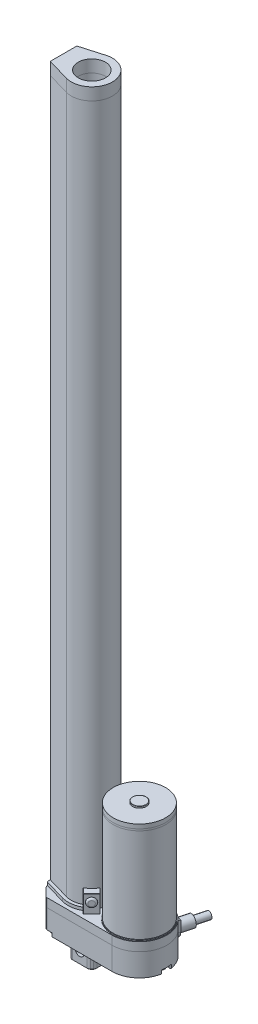
from build123d import *

# Parameters (mm, degrees)
BOSS_EXTRUDE1_DEPTH    = 6.35
SKETCH6_R              = 19.431
BOSS_EXTRUDE4_DEPTH    = 0.762
SKETCH7_R              = 19.05
BOSS_EXTRUDE5_DEPTH    = 68.326
FILLET6_R              = 5.08
FILLET7_R              = 1.905
BOSS_EXTRUDE15_DEPTH   = 6.35
SKETCH24_R             = 4.064
BOSS_EXTRUDE16_DEPTH   = 10.16
SKETCH25_R             = 2.54
BOSS_EXTRUDE17_DEPTH   = 10.16
BOSS_EXTRUDE19_DEPTH   = 16.51
FILLET13_R             = 1.905
FILLET14_R             = 5.08
BOSS_EXTRUDE20_DEPTH   = 18.796
CHAMFER1_SIZE          = 2.54
FILLET15_R             = 2.54
CHAMFER2_SIZE          = 0.762
SKETCH27_R             = 3.175
CUT_EXTRUDE3_DEPTH     = 19.05
SKETCH28_R             = 19.05
BOSS_EXTRUDE22_DEPTH   = 1.27
SKETCH29_R             = 19.05
BOSS_EXTRUDE24_DEPTH   = 3.048
BOSS_EXTRUDE25_START   = 4.318
SKETCH8_R              = 4.953
BOSS_EXTRUDE25_DEPTH   = 1.27
FILLET16_R             = 0.2286
BOSS_EXTRUDE26_DEPTH   = 508.381
BOSS_EXTRUDE27_DEPTH   = 8.89
BOSS_EXTRUDE30_DEPTH   = 2.159
BOSS_EXTRUDE31_DEPTH   = 2.159
BOSS_EXTRUDE33_DEPTH   = 12.7
BOSS_EXTRUDE33_2_DEPTH = 12.7
FILLET17_R             = 0.2286
FILLET18_R             = 0.2286
SKETCH43_R             = 3.175
BOSS_EXTRUDE34_DEPTH   = 1.27
FILLET19_R             = 1.27
SKETCH44_R             = 3.175
BOSS_EXTRUDE35_DEPTH   = 1.27
FILLET20_R             = 1.27
CUT_EXTRUDE5_START     = -2.54
CUT_EXTRUDE5_DEPTH     = 2.54
CUT_EXTRUDE6_START     = -2.54
CUT_EXTRUDE6_DEPTH     = 2.54
SKETCH47_R             = 2.54
BOSS_EXTRUDE36_DEPTH   = 2.54
BOSS_EXTRUDE36_2_DEPTH = 2.54
BOSS_EXTRUDE36_3_DEPTH = 2.54
FILLET22_R             = 1.524
FILLET23_R             = 1.524
SKETCH48_R             = 3.81
BOSS_EXTRUDE37_DEPTH   = 1.524
FILLET24_R             = 1.524
FILLET25_R             = 1.524
SKETCH49_R             = 3.81
CUT_EXTRUDE7_DEPTH     = 2.54
SKETCH50_R             = 3.556
BOSS_EXTRUDE39_DEPTH   = 2.54
SKETCH33_R             = 9.906
CUT_EXTRUDE12_DEPTH    = 518.16


with BuildPart() as part:
    # Sketch1 → Boss-Extrude1 (new body)
    with BuildSketch(Plane(origin=(0, 0, 0), x_dir=(1, 0, 0), z_dir=(0, 1, 0))):
        with BuildLine():
            Line((0, 32.639), (7.239, 39.878))
            Line((7.239, 39.878), (55.118, 39.878))
            ThreePointArc((55.118, 39.878), (75.057, 19.939), (55.118, 0))
            Line((55.118, 0), (7.239, 0))
            Line((7.239, 0), (0, 7.239))
            Line((0, 7.239), (0, 32.639))
        make_face()
    extrude(amount=BOSS_EXTRUDE1_DEPTH)

    # Fillet6
    fillet6_edges = [part.edges().sort_by_distance(p)[0] for p in [
        (0, 3.175, -7.239),
        (0, 3.175, -32.639),
    ]]
    fillet(fillet6_edges, radius=FILLET6_R)

    # Fillet7
    fillet7_edges = [part.edges().sort_by_distance(p)[0] for p in [
        (7.239, 3.175, 0),
        (7.239, 3.175, -39.878),
    ]]
    fillet(fillet7_edges, radius=FILLET7_R)


with BuildPart() as body_2:
    # Sketch6 → Boss-Extrude4 (new body)
    with BuildSketch(Plane(origin=(0, 6.35, 0), x_dir=(1, 0, 0), z_dir=(0, 1, 0))):
        with Locations(Location((55.118, 19.939, 0), (0, 0, 90))):
            Circle(SKETCH6_R)
    extrude(amount=BOSS_EXTRUDE4_DEPTH)


with BuildPart() as body_3:
    # Sketch7 → Boss-Extrude5 (new body)
    with BuildSketch(Plane(origin=(0, 7.112, 0), x_dir=(1, 0, 0), z_dir=(0, 1, 0))):
        with Locations(Location((55.118, 19.939, 0), (0, 0, 270))):
            Circle(SKETCH7_R)
    extrude(amount=BOSS_EXTRUDE5_DEPTH)


with BuildPart() as body_4:
    # Sketch23 → Boss-Extrude15 (new body)
    with BuildSketch(Plane(origin=(12.522748088, 0, -46.735532116), x_dir=(0, -1, 0), z_dir=(0.25881904510252135, 0, -0.9659258262890681))):
        with BuildLine():
            Line((-2.032, -53.883866243), (5.588, -53.883866243))
            ThreePointArc((5.588, -53.883866243), (11.303, -48.168866243), (5.588, -42.453866243))
            Line((5.588, -42.453866243), (-2.032, -42.453866243))
            Line((-2.032, -42.453866243), (-2.032, -53.883866243))
        make_face()
    extrude(amount=BOSS_EXTRUDE15_DEPTH)

    # Sketch24 → Boss-Extrude16 (add)
    with BuildSketch(Plane(origin=(14.166249025, 0, -52.869161113), x_dir=(-0.9659258262890682, 0, -0.25881904510252135), z_dir=(0.2588190451025213, 0, -0.9659258262890681))):
        with Locations((-48.168866243, -5.588)):
            Circle(SKETCH24_R)
    extrude(amount=BOSS_EXTRUDE16_DEPTH)

    # Sketch25 → Boss-Extrude17 (add)
    with BuildSketch(Plane(origin=(16.795850523, 0, -62.682967508), x_dir=(-0.9659258262890681, 0, -0.25881904510252135), z_dir=(0.25881904510252135, 0, -0.9659258262890681))):
        with Locations((-48.168866243, -5.588)):
            Circle(SKETCH25_R)
    extrude(amount=BOSS_EXTRUDE17_DEPTH)


with BuildPart() as body_5:
    # Sketch1<3> → Boss-Extrude19 (new body)
    with BuildSketch(Plane(origin=(0, 0, 0), x_dir=(1, 0, 0), z_dir=(0, 1, 0))):
        with BuildLine():
            Line((0, 32.639), (7.239, 39.878))
            Line((7.239, 39.878), (55.118, 39.878))
            ThreePointArc((55.118, 39.878), (75.057, 19.939), (55.118, 0))
            Line((55.118, 0), (7.239, 0))
            Line((7.239, 0), (0, 7.239))
            Line((0, 7.239), (0, 32.639))
        make_face()
    extrude(amount=-BOSS_EXTRUDE19_DEPTH)

    # Fillet13
    fillet13_edges = [body_5.edges().sort_by_distance(p)[0] for p in [
        (7.239, -8.255, 0),
        (7.239, -8.255, -39.878),
    ]]
    fillet(fillet13_edges, radius=FILLET13_R)

    # Fillet14
    fillet14_edges = [body_5.edges().sort_by_distance(p)[0] for p in [
        (0, -8.255, -7.239),
        (0, -8.255, -32.639),
    ]]
    fillet(fillet14_edges, radius=FILLET14_R)

    # Sketch45 → Cut-Extrude5 (cut)
    with BuildSketch(Plane.XZ.offset(16.51).offset(CUT_EXTRUDE5_START)):
        with BuildLine():
            ThreePointArc((5.044290367, -35.978344089), (4.718699387, -36.549691761), (4.084467985, -36.723467985))
            Line((4.084467985, -36.723467985), (6.681038418, -39.320038418))
            ThreePointArc((6.681038418, -39.320038418), (7.299064898, -39.732990509), (8.028076836, -39.878))
            Line((8.028076836, -39.878), (11.393838428, -39.878))
            ThreePointArc((11.393838428, -39.878), (11.138454644, -39.419455597), (11.282110896, -38.914632134))
            ThreePointArc((11.282110896, -38.914632134), (10.476958507, -32.531164357), (5.044290367, -35.978344089))
        make_face()
        with BuildLine():
            ThreePointArc((11.282110896, -0.963367866), (11.138454644, -0.458544403), (11.393838428, 0))
            Line((11.393838428, 0), (8.028076836, 0))
            ThreePointArc((8.028076836, 0), (7.299064898, -0.145009491), (6.681038418, -0.557961582))
            Line((6.681038418, -0.557961582), (4.084467985, -3.154532015))
            ThreePointArc((4.084467985, -3.154532015), (4.718699387, -3.328308239), (5.044290367, -3.899655911))
            ThreePointArc((5.044290367, -3.899655911), (10.476958507, -7.346835643), (11.282110896, -0.963367866))
        make_face()
    extrude(amount=CUT_EXTRUDE5_DEPTH, mode=Mode.SUBTRACT)

    # Sketch45<3> → Cut-Extrude6 (cut)
    with BuildSketch(Plane.XZ.offset(16.51).offset(CUT_EXTRUDE6_START)):
        with BuildLine():
            Line((4.084467985, -36.723467985), (6.681038418, -39.320038418))
            ThreePointArc((6.681038418, -39.320038418), (7.299064898, -39.732990509), (8.028076836, -39.878))
            Line((8.028076836, -39.878), (11.393838428, -39.878))
            ThreePointArc((11.393838428, -39.878), (11.138454644, -39.419455597), (11.282110896, -38.914632134))
            ThreePointArc((11.282110896, -38.914632134), (10.476958507, -32.531164357), (5.044290367, -35.978344089))
            ThreePointArc((5.044290367, -35.978344089), (4.718699387, -36.549691761), (4.084467985, -36.723467985))
        make_face()
        with BuildLine():
            Line((11.393838428, 0), (8.028076836, 0))
            ThreePointArc((8.028076836, 0), (7.299064898, -0.145009491), (6.681038418, -0.557961582))
            Line((6.681038418, -0.557961582), (4.084467985, -3.154532015))
            ThreePointArc((4.084467985, -3.154532015), (4.718699387, -3.328308239), (5.044290367, -3.899655911))
            ThreePointArc((5.044290367, -3.899655911), (10.476958507, -7.346835643), (11.282110896, -0.963367866))
            ThreePointArc((11.282110896, -0.963367866), (11.138454644, -0.458544403), (11.393838428, 0))
        make_face()
        with BuildLine():
            ThreePointArc((73.662109712, -16.992248385), (67.437, -19.939), (73.662109712, -22.885751615))
            ThreePointArc((73.662109712, -22.885751615), (74.341584064, -23.041280193), (74.712069674, -23.631716426))
            ThreePointArc((74.712069674, -23.631716426), (75.057, -19.939), (74.712069674, -16.246283574))
            ThreePointArc((74.712069674, -16.246283574), (74.341584064, -16.836719807), (73.662109712, -16.992248385))
        make_face()
    extrude(amount=CUT_EXTRUDE6_DEPTH, mode=Mode.SUBTRACT)


with BuildPart() as body_6:
    # Sketch26 → Boss-Extrude20 (new body)
    with BuildSketch(Plane(origin=(0, -16.51, 0), x_dir=(-1, 0, 0), z_dir=(0, -1, 0))):
        Polygon((-20.574, 28.829), (-11.684, 28.829), (-11.684, 11.049), (-29.464, 11.049), (-29.464, 28.829), align=None)
    extrude(amount=BOSS_EXTRUDE20_DEPTH)

    # Chamfer1
    chamfer1_edges = [body_6.edges().sort_by_distance(p)[0] for p in [
        (11.684, -25.908, -11.049),
        (29.464, -25.908, -11.049),
        (29.464, -25.908, -28.829),
        (11.684, -25.908, -28.829),
    ]]
    chamfer(chamfer1_edges, length=CHAMFER1_SIZE)

    # Fillet15
    fillet15_edges = [body_6.edges().sort_by_distance(p)[0] for p in [
        (29.464, -25.908, -13.589),
        (29.464, -25.908, -26.289),
        (14.224, -25.908, -28.829),
        (26.924, -25.908, -28.829),
        (14.224, -25.908, -11.049),
        (26.924, -25.908, -11.049),
        (11.684, -25.908, -26.289),
        (11.684, -25.908, -13.589),
    ]]
    fillet(fillet15_edges, radius=FILLET15_R)

    # Chamfer2
    chamfer2_edges = [body_6.edges().sort_by_distance(p)[0] for p in [
        (11.684, -35.306, -19.939),
        (12.954, -35.306, -12.319),
        (20.574, -35.306, -28.829),
        (28.194, -35.306, -27.559),
        (29.464, -35.306, -19.939),
        (28.194, -35.306, -12.319),
        (20.574, -35.306, -11.049),
        (12.954, -35.306, -27.559),
        (14.30408653, -35.306, -28.635654013),
        (11.877345987, -35.306, -26.20891347),
        (26.84391347, -35.306, -28.635654013),
        (29.270654013, -35.306, -26.20891347),
        (29.270654013, -35.306, -13.66908653),
        (26.84391347, -35.306, -11.242345987),
        (14.30408653, -35.306, -11.242345987),
        (11.877345987, -35.306, -13.66908653),
    ]]
    chamfer(chamfer2_edges, length=CHAMFER2_SIZE)

    # Sketch27 → Cut-Extrude3 (cut)
    with BuildSketch(Plane.XY.offset(-11.049)):
        with Locations((20.574, -26.67)):
            Circle(SKETCH27_R)
    extrude(amount=-CUT_EXTRUDE3_DEPTH, mode=Mode.SUBTRACT)


with BuildPart() as body_7:
    # Sketch28 → Boss-Extrude22 (new body)
    with BuildSketch(Plane(origin=(0, 75.438, 0), x_dir=(1, 0, 0), z_dir=(0, 1, 0))):
        with Locations(Location((55.118, 19.939, 0), (0, 0, 270))):
            Circle(SKETCH28_R)
    extrude(amount=BOSS_EXTRUDE22_DEPTH)


with BuildPart() as body_8:
    # Sketch29 → Boss-Extrude24 (new body)
    with BuildSketch(Plane(origin=(0, 76.708, 0), x_dir=(1, 0, 0), z_dir=(0, 1, 0))):
        with Locations(Location((55.118, 19.939, 0), (0, 0, 90))):
            Circle(SKETCH29_R)
    extrude(amount=BOSS_EXTRUDE24_DEPTH)

    # Sketch8 → Boss-Extrude25 (add)
    with BuildSketch(Plane(origin=(0, 75.438, 0), x_dir=(1, 0, 0), z_dir=(0, 1, 0)).offset(BOSS_EXTRUDE25_START)):
        with Locations(Location((55.118, 19.939, 0), (0, 0, 270))):
            Circle(SKETCH8_R)
    extrude(amount=BOSS_EXTRUDE25_DEPTH)

    # Fillet16
    fillet16_edges = [body_8.edges().sort_by_distance(p)[0] for p in [
        (55.118, 81.026, -24.892),
    ]]
    fillet(fillet16_edges, radius=FILLET16_R)


with BuildPart() as body_9:
    # Sketch15 → Boss-Extrude26 (new body)
    with BuildSketch(Plane(origin=(0, 6.35, 0), x_dir=(1, 0, 0), z_dir=(0, 1, 0))):
        with BuildLine():
            Line((0, 19.939), (0, 10.286870396))
            Line((0, 10.286870396), (16.411980417, 5.54225678))
            ThreePointArc((16.411980417, 5.54225678), (35.560281138, 19.939054609), (16.411875495, 34.335712887))
            Line((16.411875495, 34.335712887), (0, 29.591))
            Line((0, 29.591), (0, 19.939))
        make_face()
    extrude(amount=BOSS_EXTRUDE26_DEPTH)

    # Sketch48 → Boss-Extrude37 (add)
    with BuildSketch(Plane.ZY):
        with Locations(Location((-19.939, 12.7, 0), (0, 0, 180))):
            Circle(SKETCH48_R)
    extrude(amount=BOSS_EXTRUDE37_DEPTH)

    # Fillet24
    fillet24_edges = [body_9.edges().sort_by_distance(p)[0] for p in [
        (-1.524, 12.7, -16.129),
    ]]
    fillet(fillet24_edges, radius=FILLET24_R - 0.0001)  # a hair under: the kernel refuses the full size

    # Sketch49 → Cut-Extrude7 (cut)
    with BuildSketch(Plane.ZY):
        with Locations((-19.938935198, 509.778)):
            Circle(SKETCH49_R)
    extrude(amount=-CUT_EXTRUDE7_DEPTH, mode=Mode.SUBTRACT)

    # Sketch50 → Boss-Extrude39 (add)
    with BuildSketch(Plane.ZY.offset(-2.54)):
        with Locations((-19.938935198, 509.778)):
            Circle(SKETCH50_R)
    extrude(amount=BOSS_EXTRUDE39_DEPTH)


with BuildPart() as body_10:
    # Sketch32 → Boss-Extrude27 (new body)
    with BuildSketch(Plane(origin=(0, 514.731, 0), x_dir=(1, 0, 0), z_dir=(0, 1, 0))):
        with BuildLine():
            Line((0, 10.286870396), (0, 29.591))
            Line((0, 29.591), (16.411875495, 34.335712887))
            ThreePointArc((16.411875495, 34.335712887), (35.560281138, 19.939054609), (16.411980417, 5.54225678))
            Line((16.411980417, 5.54225678), (0, 10.286870396))
        make_face()
    extrude(amount=BOSS_EXTRUDE27_DEPTH)


with BuildPart() as body_11:
    # Sketch41 → Boss-Extrude30 (new body)
    with BuildSketch(Plane(origin=(0, 6.35, 0), x_dir=(1, 0, 0), z_dir=(0, 1, 0))):
        with BuildLine():
            Line((0, 29.591), (16.411875495, 34.335712887))
            ThreePointArc((16.411875495, 34.335712887), (22.021175201, 34.855243035), (27.425990452, 33.267122493))
            Line((27.425990452, 33.267122493), (29.11221422, 34.953346261))
            ThreePointArc((29.11221422, 34.953346261), (22.604273469, 37.091541659), (15.776987058, 36.531780434))
            Line((15.776987058, 36.531780434), (0.2736806, 32.049737053))
            Line((0.2736806, 32.049737053), (0, 30.534795103))
            Line((0, 30.534795103), (0, 29.591))
        make_face()
    extrude(amount=BOSS_EXTRUDE30_DEPTH)


with BuildPart() as body_12:
    # Sketch41<11> → Boss-Extrude31 (new body)
    with BuildSketch(Plane(origin=(0, 6.35, 0), x_dir=(1, 0, 0), z_dir=(0, 1, 0))):
        with BuildLine():
            Line((16.411875495, 5.542157508), (0, 10.286870396))
            Line((0, 10.286870396), (0, 9.343204897))
            Line((0, 9.343204897), (0, 9.343075292))
            Line((0, 9.343075292), (0.2736806, 7.828133343))
            Line((0.2736806, 7.828133343), (15.776987058, 3.346089961))
            ThreePointArc((15.776987058, 3.346089961), (22.604273469, 2.786328737), (29.11221422, 4.924524135))
            Line((29.11221422, 4.924524135), (27.425990452, 6.610747903))
            ThreePointArc((27.425990452, 6.610747903), (22.021175201, 5.02262736), (16.411875495, 5.542157508))
        make_face()
    extrude(amount=BOSS_EXTRUDE31_DEPTH)


with BuildPart() as body_13:
    # Sketch41<12> → Boss-Extrude33 (new body)
    with BuildSketch(Plane(origin=(0, 6.35, 0), x_dir=(1, 0, 0), z_dir=(0, 1, 0))):
        with BuildLine():
            Line((29.11221422, 34.953346261), (27.425990452, 33.267122493))
            ThreePointArc((27.425990452, 33.267122493), (31.070982239, 30.634886416), (33.77116823, 27.039941701))
            Line((33.77116823, 27.039941701), (37.542875801, 30.811649272))
            Line((37.542875801, 30.811649272), (31.256696516, 37.097828557))
            Line((31.256696516, 37.097828557), (29.11221422, 34.953346261))
        make_face()
    extrude(amount=BOSS_EXTRUDE33_DEPTH)

    # Fillet17
    fillet17_edges = [body_13.edges().sort_by_distance(p)[0] for p in [
        (35.657022016, 19.05, -28.925795487),
        (34.399786159, 19.05, -33.954738915),
        (29.341343484, 19.05, -35.182475525),
        (31.256696516, 12.7, -37.097828557),
        (37.542875801, 12.7, -30.811649272),
    ]]
    fillet(fillet17_edges, radius=FILLET17_R)


with BuildPart() as body_14:
    # Sketch41<12> → Boss-Extrude33 2 (new body)
    with BuildSketch(Plane(origin=(0, 6.35, 0), x_dir=(1, 0, 0), z_dir=(0, 1, 0))):
        with BuildLine():
            Line((31.256696516, 2.780041839), (37.542875801, 9.066221123))
            Line((37.542875801, 9.066221123), (33.77116823, 12.837928694))
            ThreePointArc((33.77116823, 12.837928694), (31.070982239, 9.24298398), (27.425990452, 6.610747903))
            Line((27.425990452, 6.610747903), (29.11221422, 4.924524135))
            Line((29.11221422, 4.924524135), (31.256696516, 2.780041839))
        make_face()
    extrude(amount=BOSS_EXTRUDE33_2_DEPTH)

    # Fillet18
    fillet18_edges = [body_14.edges().sort_by_distance(p)[0] for p in [
        (34.399786159, 19.05, -5.923131481),
        (35.657022016, 19.05, -10.952074909),
        (29.341343484, 19.05, -4.695394871),
        (37.542875801, 12.7, -9.066221123),
        (31.256696516, 12.7, -2.780041839),
    ]]
    fillet(fillet18_edges, radius=FILLET18_R)


with BuildPart() as body_15:
    # Sketch43 → Boss-Extrude34 (new body)
    with BuildSketch(Plane(origin=(34.177262537, 0, -34.177262537), x_dir=(-0.7071067811865481, 0, -0.7071067811865469), z_dir=(0.7071067811865469, 0, -0.7071067811865481))):
        with Locations(Location((-0.314695924, 13.7414, 0), (0, 0, 180))):
            Circle(SKETCH43_R)
    extrude(amount=BOSS_EXTRUDE34_DEPTH)

    # Fillet19
    fillet19_edges = [body_15.edges().sort_by_distance(p)[0] for p in [
        (33.052747741, 13.7414, -37.097828557),
    ]]
    fillet(fillet19_edges, radius=FILLET19_R - 0.0001)  # a hair under: the kernel refuses the full size


with BuildPart() as body_16:
    # Sketch44 → Boss-Extrude35 (new body)
    with BuildSketch(Plane(origin=(14.238327339, 0, 14.238327339), x_dir=(0.7071067811865481, 0, -0.7071067811865469), z_dir=(0.7071067811865469, 0, 0.7071067811865481))):
        with Locations(Location((28.5126085, 13.7414, 0), (0, 0, 180))):
            Circle(SKETCH44_R)
    extrude(amount=BOSS_EXTRUDE35_DEPTH)

    # Fillet20
    fillet20_edges = [body_16.edges().sort_by_distance(p)[0] for p in [
        (37.542875801, 13.7414, -7.270169899),
    ]]
    fillet(fillet20_edges, radius=FILLET20_R - 0.0001)  # a hair under: the kernel refuses the full size


with BuildPart() as body_17:
    # Sketch47 → Boss-Extrude36 (new body)
    with BuildSketch(Plane(origin=(0, -13.97, 0), x_dir=(-1, 0, 0), z_dir=(0, -1, 0))):
        with Locations(Location((-8.854290367, 35.978344089, 0), (0, 0, 90))):
            Circle(SKETCH47_R)
    extrude(amount=BOSS_EXTRUDE36_DEPTH)

    # Fillet22
    fillet22_edges = [body_17.edges().sort_by_distance(p)[0] for p in [
        (8.854290367, -16.51, -33.438344089),
    ]]
    fillet(fillet22_edges, radius=FILLET22_R)


with BuildPart() as body_18:
    # Sketch47 → Boss-Extrude36 2 (new body)
    with BuildSketch(Plane(origin=(0, -13.97, 0), x_dir=(-1, 0, 0), z_dir=(0, -1, 0))):
        with Locations(Location((-8.854290367, 3.899655911, 0), (0, 0, 90))):
            Circle(SKETCH47_R)
    extrude(amount=BOSS_EXTRUDE36_2_DEPTH)

    # Fillet23
    fillet23_edges = [body_18.edges().sort_by_distance(p)[0] for p in [
        (8.854290367, -16.51, -1.359655911),
    ]]
    fillet(fillet23_edges, radius=FILLET23_R)


with BuildPart() as body_19:
    # Sketch47 → Boss-Extrude36 3 (new body)
    with BuildSketch(Plane(origin=(0, -13.97, 0), x_dir=(-1, 0, 0), z_dir=(0, -1, 0))):
        with Locations(Location((-71.247, 19.939, 0), (0, 0, 90))):
            Circle(SKETCH47_R)
    extrude(amount=BOSS_EXTRUDE36_3_DEPTH)

    # Fillet25
    fillet25_edges = [body_19.edges().sort_by_distance(p)[0] for p in [
        (71.247, -16.51, -17.399),
    ]]
    fillet(fillet25_edges, radius=FILLET25_R)


with BuildPart() as cut_extrude12_tool:
    # Sketch33 → Cut-Extrude12 (new body)
    with BuildSketch(Plane(origin=(0, 523.621, 0), x_dir=(1, 0, 0), z_dir=(0, 1, 0))):
        with Locations(Location((20.574, 19.939, 0), (0, 0, 270))):
            Circle(SKETCH33_R)
    extrude(amount=-CUT_EXTRUDE12_DEPTH)


with BuildPart() as part_1:
    add(part.part)

    # Cut-Extrude12: cut by cut_extrude12_tool
    add(cut_extrude12_tool.part, mode=Mode.SUBTRACT)


with BuildPart() as body_9_1:
    add(body_9.part)

    # Cut-Extrude12: cut by cut_extrude12_tool
    add(cut_extrude12_tool.part, mode=Mode.SUBTRACT)


with BuildPart() as body_10_1:
    add(body_10.part)

    # Cut-Extrude12: cut by cut_extrude12_tool
    add(cut_extrude12_tool.part, mode=Mode.SUBTRACT)


solid = Compound([body_2.part, body_3.part, body_4.part, body_5.part, body_6.part, body_7.part, body_8.part, body_11.part, body_12.part, body_13.part, body_14.part, body_15.part, body_16.part, body_17.part, body_18.part, body_19.part, part_1.part, body_9_1.part, body_10_1.part])
